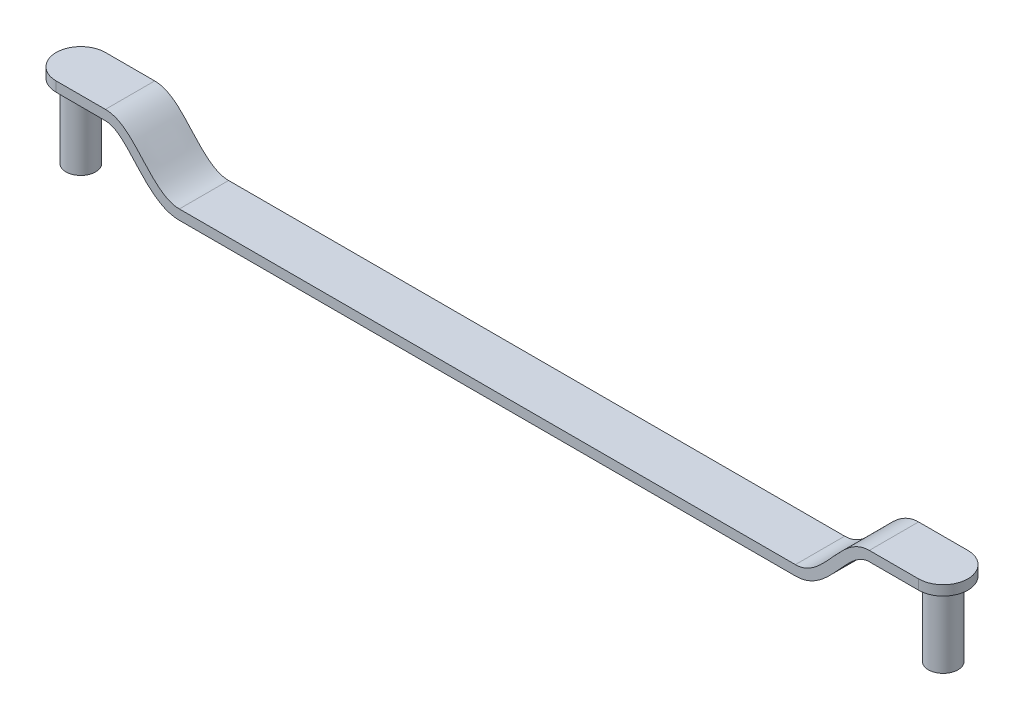
from build123d import *

# Parameters (mm, degrees)
SKETCH1_R             = 30
BOSS_EXTRUDE1_DEPTH   = 150
BOSS_EXTRUDE1_2_DEPTH = 150
EXTRUDE_THIN1_START   = -100
EXTRUDE_THIN1_DEPTH   = 100
SKETCH2_OUTSIDE_W     = 2224.156
SKETCH2_OUTSIDE_H     = 474.106
CUT_EXTRUDE1_DEPTH    = 100


# Read off the part's stored shape, not the designer's step: Extrude-Thin1
with BuildPart() as part:
    # Sketch1 → Boss-Extrude1 (new body)
    with BuildSketch(Plane(origin=(0, 0, 0), x_dir=(1, 0, 0), z_dir=(0, 1, 0))):
        with Locations(Location((0, 0, 0), (0, 0, 270))):
            Circle(SKETCH1_R)
    extrude(amount=-BOSS_EXTRUDE1_DEPTH)



with BuildPart() as body_2:
    # Sketch1 → Boss-Extrude1 2 (new body)
    with BuildSketch(Plane(origin=(0, 0, 0), x_dir=(1, 0, 0), z_dir=(0, 1, 0))):
        with Locations(Location((-1750.05, 0, 0), (0, 0, 270))):
            Circle(SKETCH1_R)
    extrude(amount=-BOSS_EXTRUDE1_2_DEPTH)


with BuildPart() as part_1:
    add(part.part)

    add(body_2.part)  # Extrude-Thin1 merges body 2
    # Extrude-Thin1 outline → Extrude-Thin1 (add)
    with BuildSketch(Plane.XY.offset(50).offset(EXTRUDE_THIN1_START)):
        with BuildLine():
            Line((-1500.05, -100), (-250, -100))
            add(Edge.make_bspline(
                [(-250, -100), (-180.532615563, -100), (-147.140452079, 0), (-100, 0)],
                knots=[0, 0, 0, 0, 1, 1, 1, 1], degree=3))
            Line((-100, 0), (50, 0))
            Line((50, 0), (50, 20))
            Line((50, 20), (-100, 20))
            add(Edge.make_bspline(
                [(-250, -80), (-246.8578922, -80), (-243.858737849, -79.72033393), (-237.993194947, -78.665321149), (-235.125426927, -77.888401959), (-229.419387385, -75.849767547), (-226.581615187, -74.586589055), (-220.900676803, -71.586264248), (-218.058608228, -69.848756808), (-212.373173985, -65.939898134), (-209.530533574, -63.76882272), (-203.856954109, -59.061240354), (-201.026304365, -56.525095932), (-195.383615818, -51.172709385), (-192.571647436, -48.356724406), (-186.962589328, -42.537122759), (-184.165515953, -39.533655599), (-178.571130319, -33.432647215), (-175.773867523, -30.335180457), (-170.151907521, -24.137576717), (-167.327345009, -21.037442901), (-161.608940626, -14.922554595), (-158.715354463, -11.907662629), (-152.79666366, -6.049585507), (-149.771886809, -3.205896979), (-143.499030151, 2.216662309), (-140.250865349, 4.796857765), (-133.403484489, 9.567046655), (-129.801981816, 11.759226892), (-124.033745357, 14.595891945), (-122.050123128, 15.465210164), (-117.953666514, 17.012030347), (-115.8406028, 17.689372637), (-111.491874555, 18.806547682), (-109.256121065, 19.246044187), (-104.688584729, 19.842959809), (-102.357022604, 20), (-100, 20)],
                knots=[0, 0, 0, 0, 0.0625, 0.0625, 0.125, 0.125, 0.1875, 0.1875, 0.25, 0.25, 0.3125, 0.3125, 0.375, 0.375, 0.4375, 0.4375, 0.5, 0.5, 0.5625, 0.5625, 0.625, 0.625, 0.6875, 0.6875, 0.75, 0.75, 0.8125, 0.8125, 0.875, 0.875, 0.90625, 0.90625, 0.9375, 0.9375, 0.96875, 0.96875, 1, 1, 1, 1], degree=3))
            Line((-250, -80), (-1500.05, -80))
            add(Edge.make_bspline(
                [(-1650.05, 20), (-1647.692977396, 20), (-1645.361415271, 19.842959809), (-1640.793878935, 19.246044187), (-1638.558125445, 18.806547682), (-1634.2093972, 17.689372637), (-1632.096333486, 17.012030347), (-1627.999876872, 15.465210164), (-1626.016254643, 14.595891945), (-1620.248018184, 11.759226892), (-1616.646515511, 9.567046655), (-1609.799134651, 4.796857765), (-1606.550969849, 2.216662309), (-1600.278113191, -3.205896979), (-1597.25333634, -6.049585507), (-1591.334645537, -11.907662629), (-1588.441059374, -14.922554595), (-1582.722654991, -21.037442901), (-1579.898092479, -24.137576717), (-1574.276132477, -30.335180457), (-1571.478869681, -33.432647215), (-1565.884484047, -39.533655599), (-1563.087410672, -42.537122759), (-1557.478352564, -48.356724406), (-1554.666384182, -51.172709385), (-1549.023695635, -56.525095932), (-1546.193045891, -59.061240354), (-1540.519466426, -63.76882272), (-1537.676826015, -65.939898134), (-1531.991391772, -69.848756808), (-1529.149323197, -71.586264248), (-1523.468384813, -74.586589055), (-1520.630612615, -75.849767547), (-1514.924573073, -77.888401959), (-1512.056805053, -78.665321149), (-1506.191262151, -79.72033393), (-1503.1921078, -80), (-1500.05, -80)],
                knots=[0, 0, 0, 0, 0.03125, 0.03125, 0.0625, 0.0625, 0.09375, 0.09375, 0.125, 0.125, 0.1875, 0.1875, 0.25, 0.25, 0.3125, 0.3125, 0.375, 0.375, 0.4375, 0.4375, 0.5, 0.5, 0.5625, 0.5625, 0.625, 0.625, 0.6875, 0.6875, 0.75, 0.75, 0.8125, 0.8125, 0.875, 0.875, 0.9375, 0.9375, 1, 1, 1, 1], degree=3))
            Line((-1650.05, 20), (-1800.05, 20))
            Line((-1800.05, 20), (-1800.05, 0))
            Line((-1800.05, 0), (-1650.05, 0))
            add(Edge.make_bspline(
                [(-1650.05, 0), (-1602.909547921, 0), (-1569.517384437, -100), (-1500.05, -100)],
                knots=[0, 0, 0, 0, 1, 1, 1, 1], degree=3))
        make_face()
    extrude(amount=EXTRUDE_THIN1_DEPTH)

    # Sketch2 outside → Cut-Extrude1 (cut)
    with BuildSketch(Plane(origin=(0, 0, 0), x_dir=(1, 0, 0), z_dir=(0, 1, 0))):
        with Locations((-875.025, 0)):
            Rectangle(SKETCH2_OUTSIDE_W, SKETCH2_OUTSIDE_H)
        with BuildLine():
            Line((0, -50), (-1750.05, -50))
            ThreePointArc((-1750.05, -50), (-1800.05, 0), (-1750.05, 50))
            Line((-1750.05, 50), (0, 50))
            ThreePointArc((0, 50), (50, 0), (0, -50))
        make_face(mode=Mode.SUBTRACT)
    extrude(amount=CUT_EXTRUDE1_DEPTH, mode=Mode.SUBTRACT)


solid = part_1.part
